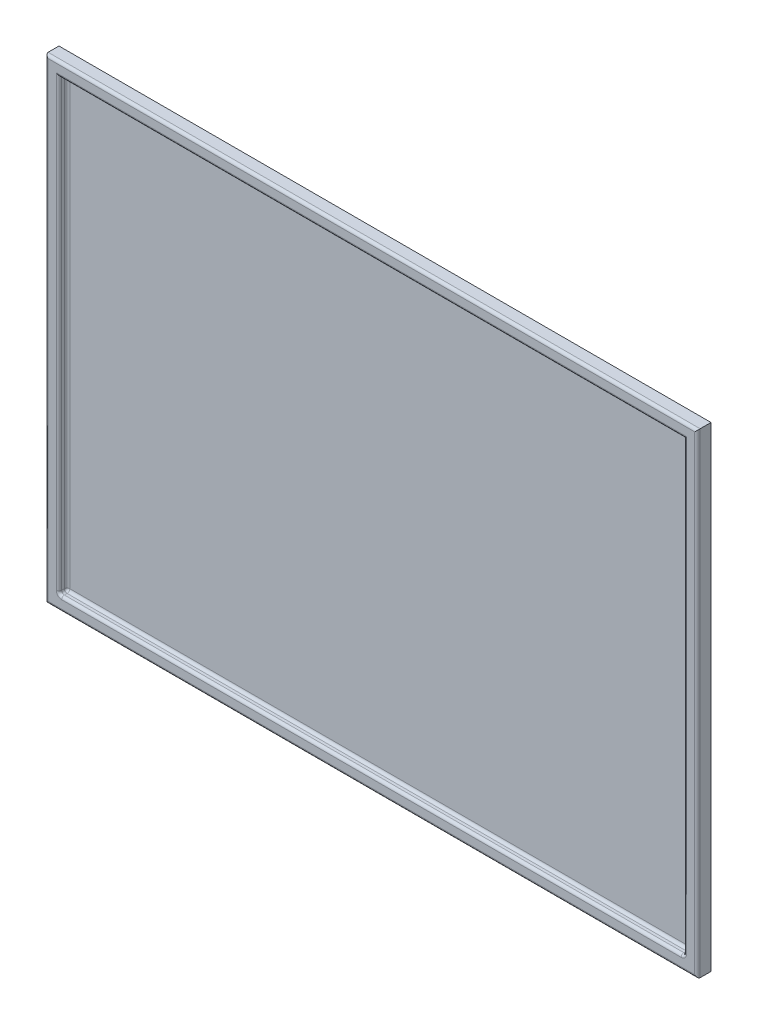
from build123d import *

# Parameters (mm, degrees)
SKETCH1_W           = 240
SKETCH1_H           = 175
BOSS_EXTRUDE1_DEPTH = 5
SKETCH2_W           = 230
SKETCH2_H           = 165
CUT_EXTRUDE1_DEPTH  = 3
FILLET1_R           = 1
FILLET2_R           = 1
FILLET3_R           = 1


with BuildPart() as part:
    # Sketch1 → Boss-Extrude1 (new body)
    with BuildSketch(Plane.XY):
        with Locations((4.817749604, -19.687004754)):
            Rectangle(SKETCH1_W, SKETCH1_H)
    extrude(amount=BOSS_EXTRUDE1_DEPTH)

    # Sketch2 → Cut-Extrude1 (cut)
    with BuildSketch(Plane.XY.offset(5)):
        with Locations((4.817749604, -19.687004754)):
            Rectangle(SKETCH2_W, SKETCH2_H)
    extrude(amount=-CUT_EXTRUDE1_DEPTH, mode=Mode.SUBTRACT)

    # Fillet1
    fillet1_edges = [part.edges().sort_by_distance(p)[0] for p in [
        (4.817749604, -102.187004754, 2),
        (119.817749604, -102.187004754, 3.5),
        (-110.182250396, -102.187004754, 3.5),
        (4.817749604, 62.812995246, 5),
        (-110.182250396, -19.687004754, 5),
        (4.817749604, -102.187004754, 5),
        (119.817749604, -19.687004754, 5),
    ]]
    fillet(fillet1_edges, radius=FILLET1_R)

    # Fillet2
    fillet2_edges = [part.edges().sort_by_distance(p)[0] for p in [
        (124.817749604, -19.687004754, 5),
        (4.817749604, 67.812995246, 5),
        (-115.182250396, -19.687004754, 5),
        (4.817749604, -107.187004754, 5),
    ]]
    fillet(fillet2_edges, radius=FILLET2_R)

    # Fillet3
    # the kernel refuses this fillet: 1 mm, written as the material it adds along each edge
    with BuildSketch(Plane(origin=(118.817749604, -101.187004754, 3), x_dir=(0, 0, -1), z_dir=(1, 0, 0))) as fillet3_piece_1_section:
        Polygon((0, 0), (FILLET3_R, 0), (FILLET3_R, -FILLET3_R), (0, -FILLET3_R), align=None)
    fillet3_piece_1 = extrude(amount=FILLET3_R, mode=Mode.PRIVATE)
    fillet3_piece_1 = fillet3_piece_1 - Plane(origin=(118.817749604, -101.187004754, 3), x_dir=(0, 0.7071067811865475, 0.7071067811865475), z_dir=(1, 0, 0)) * Sphere(FILLET3_R, mode=Mode.PRIVATE)
    add(fillet3_piece_1)
    with BuildSketch(Plane(origin=(-109.182250396, -101.187004754, 3), x_dir=(0, 0, -1), z_dir=(-1, 0, 0))) as fillet3_piece_2_section:
        Polygon((0, 0), (FILLET3_R, 0), (FILLET3_R, FILLET3_R), (0, FILLET3_R), align=None)
    fillet3_piece_2 = extrude(amount=FILLET3_R, mode=Mode.PRIVATE)
    fillet3_piece_2 = fillet3_piece_2 - Plane(origin=(-109.182250396, -101.187004754, 3), x_dir=(0, 0.7071067811865475, 0.7071067811865475), z_dir=(-1, 0, 0)) * Sphere(FILLET3_R, mode=Mode.PRIVATE)
    add(fillet3_piece_2)
    with BuildSketch(Plane(origin=(122.317749604, 62.812995246, 2), x_dir=(0, 0, 1), z_dir=(-1, 0, 0))) as fillet3_piece_3:
        with BuildLine():
            CenterArc((FILLET3_R, -FILLET3_R), FILLET3_R, 90, 90)
            Line((0, -FILLET3_R), (0, 0))
            Line((0, 0), (FILLET3_R, 0))
        make_face()
    extrude(amount=235)
    with BuildSketch(Plane(origin=(-110.182250396, 65.312995246, 2), x_dir=(0, 0, 1), z_dir=(0, -1, 0)), Plane(origin=(119.817749604, -101.187004754, 2), x_dir=(0, 0, 1), z_dir=(0, 1, 0))) as fillet3_piece_4:
        with BuildLine():
            CenterArc((FILLET3_R, -FILLET3_R), FILLET3_R, 90, 90)
            Line((0, -FILLET3_R), (0, 0))
            Line((0, 0), (FILLET3_R, 0))
        make_face()
    extrude(amount=166.5)


solid = part.part
